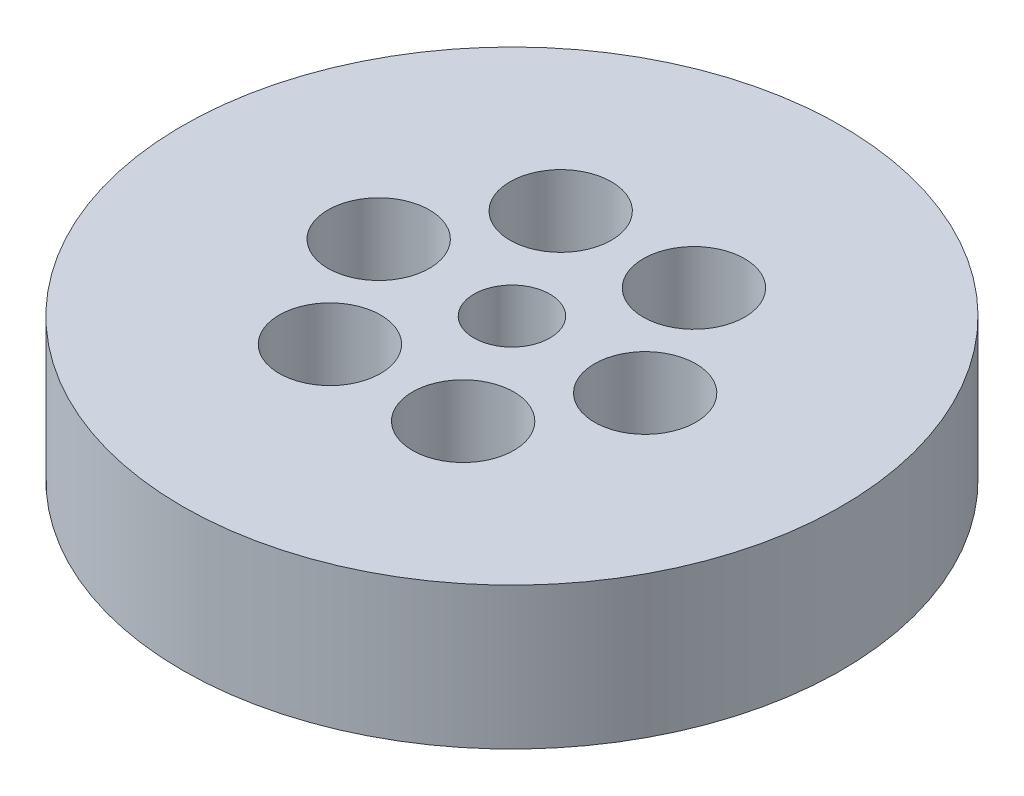
from build123d import *

# Parameters (mm, degrees)
SKETCH1_R           = 65
BOSS_EXTRUDE1_DEPTH = 28
SKETCH2_R           = 7.5
CUT_EXTRUDE1_DEPTH  = 97.093704268
SKETCH3_R           = 10
CUT_EXTRUDE2_DEPTH  = 27.485991172
CIRPATTERN1_COUNT   = 6


with BuildPart() as part:
    # Sketch1 → Boss-Extrude1 (new body)
    with BuildSketch(Plane(origin=(0, 0, 0), x_dir=(1, 0, 0), z_dir=(0, 1, 0))):
        Circle(SKETCH1_R)
    extrude(amount=BOSS_EXTRUDE1_DEPTH)

    # Sketch2 → Cut-Extrude1 (cut, through all)
    with BuildSketch(Plane(origin=(0, 0, 0), x_dir=(1, 0, 0), z_dir=(0, 1, 0))):
        Circle(SKETCH2_R)
    extrude(amount=CUT_EXTRUDE1_DEPTH, mode=Mode.SUBTRACT)

    # Sketch3 → Cut-Extrude2 (cut)
    with BuildSketch(Plane(origin=(0, 28, 0), x_dir=(1, 0, 0), z_dir=(0, 1, 0))):
        with Locations((-26.279472332, 0)):
            Circle(SKETCH3_R)
    cut_extrude2 = extrude(amount=-CUT_EXTRUDE2_DEPTH, mode=Mode.SUBTRACT)

    # CirPattern1: Cut-Extrude2 ×6 about axis
    cirpattern1_axis = Axis((0, 0, 0), (0, 1, 0))
    for i in range(1, CIRPATTERN1_COUNT):
        add(cut_extrude2.rotate(cirpattern1_axis, i * 360 / CIRPATTERN1_COUNT), mode=Mode.SUBTRACT)


solid = part.part
